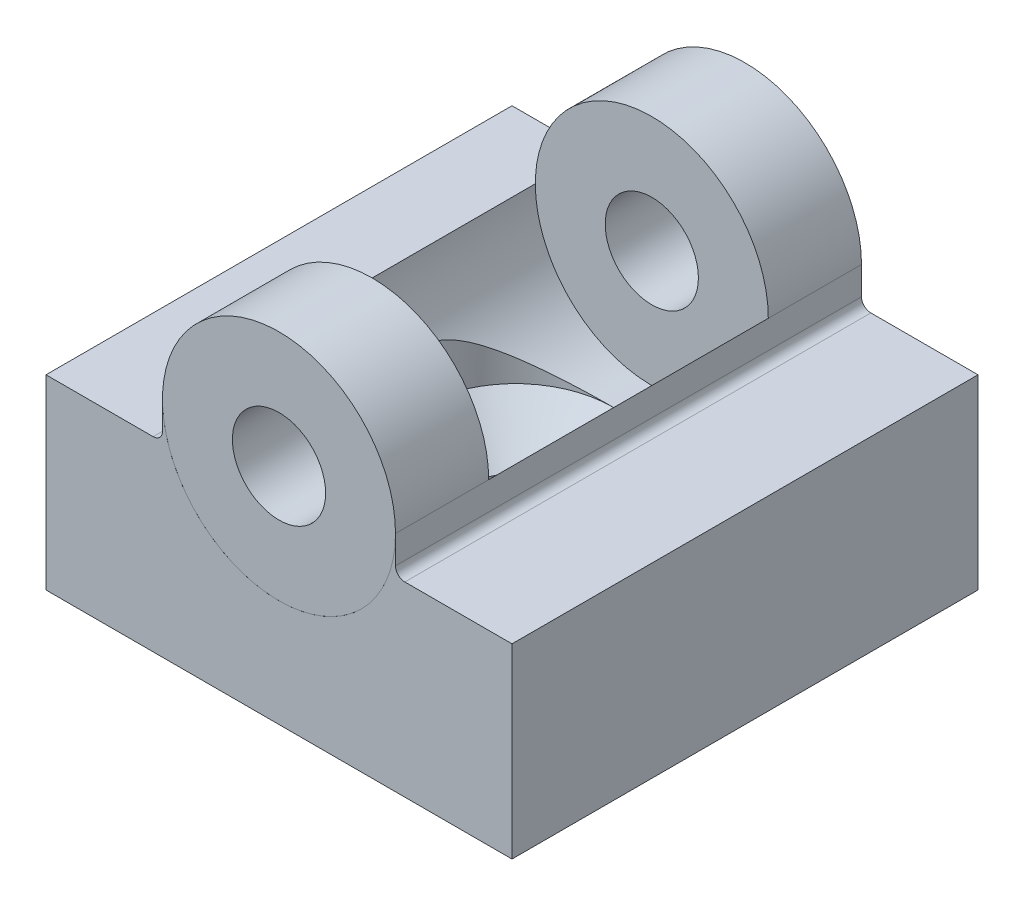
from build123d import *

# Parameters (mm, degrees)
SKETCH2_R           = 6.25
BOSS_EXTRUDE1_DEPTH = 25
BOSS_EXTRUDE2_DEPTH = 25
SKETCH5_R           = 2.5
CUT_EXTRUDE1_DEPTH  = 25
FILLET1_R           = 0.5
SKETCH6_W           = 25
SKETCH6_H           = 15
CUT_EXTRUDE2_DEPTH  = 10
SKETCH8_R           = 6.5
CUT_EXTRUDE5_DEPTH  = 15


# Read off the part's stored shape, not the designer's step: CSK for M5 Flat Head Machine Screw4
with BuildPart() as part:
    # Sketch2 → Boss-Extrude1 (new body)
    with BuildSketch(Plane.XY):
        Circle(SKETCH2_R)
    extrude(amount=-BOSS_EXTRUDE1_DEPTH)

    # Sketch5 → Cut-Extrude1 (cut)
    with BuildSketch(Plane.XY):
        Circle(SKETCH5_R)
    extrude(amount=-CUT_EXTRUDE1_DEPTH, mode=Mode.SUBTRACT)

    # Sketch6 → Cut-Extrude2 (cut)
    with BuildSketch(Plane(origin=(0, -2, 0), x_dir=(1, 0, 0), z_dir=(0, 1, 0))):
        with Locations((0, 12.5)):
            Rectangle(SKETCH6_W, SKETCH6_H)
    extrude(amount=CUT_EXTRUDE2_DEPTH, mode=Mode.SUBTRACT)

    # Sketch8 → Cut-Extrude5 (cut)
    with BuildSketch(Plane.XY.offset(-20)):
        Circle(SKETCH8_R)
    extrude(amount=CUT_EXTRUDE5_DEPTH, mode=Mode.SUBTRACT)


with BuildPart() as body_2:
    # Sketch4 → Boss-Extrude2 (new body)
    with BuildSketch(Plane.XY):
        with BuildLine():
            Line((-6.25, 0), (-6.25, -2))
            Line((-6.25, -2), (-12.5, -2))
            Line((-12.5, -2), (-12.5, -12))
            Line((-12.5, -12), (12.5, -12))
            Line((12.5, -12), (12.5, -2))
            Line((12.5, -2), (6.25, -2))
            Line((6.25, -2), (6.25, 0))
            ThreePointArc((6.25, 0), (0, -6.25), (-6.25, 0))
        make_face()
    extrude(amount=-BOSS_EXTRUDE2_DEPTH)

    # Fillet1
    fillet1_edges = [body_2.edges().sort_by_distance(p)[0] for p in [
        (6.25, -2, -12.5),
        (-6.25, -2, -12.5),
    ]]
    fillet(fillet1_edges, radius=FILLET1_R)

    # CSK for M5 Flat Head Machine Screw4 outl → CSK for M5 Flat Head Machine Screw4 (revolve, cut)
    with BuildSketch(Plane(origin=(0, 0, -12.753983412), x_dir=(0.9999862042460785, -0.005252743808715838, 0), z_dir=(0, 0, 1))):
        Polygon((2.75, -8.7), (5.2, -6.25), (5.2, -3.466872661), (2.75, -3.466872661), align=None)
        Polygon((2.75, -12.014610796), (2.75, -8.7), (2.75, -3.466872661), (0, -3.466872661), (0, -12.014610796), align=None)
    revolve(axis=Axis((0, 0, -12.753983412), (0.005252743808715838, 0.9999862042460785, 0)), mode=Mode.SUBTRACT)


with BuildPart() as cut_extrude5_piece_1:
    # of the separate pieces the step leaves, piece 1, a body of its own (cut_extrude5_pieces)
    add(part.part.solids().sort_by_distance((6.25, 0, 0))[0])


with BuildPart() as cut_extrude5_piece_2:
    # of the separate pieces the step leaves, piece 2, a body of its own (cut_extrude5_pieces)
    add(part.part.solids().sort_by_distance((6.25, 0, -20))[0])


solid = Compound([body_2.part, cut_extrude5_piece_1.part, cut_extrude5_piece_2.part])
